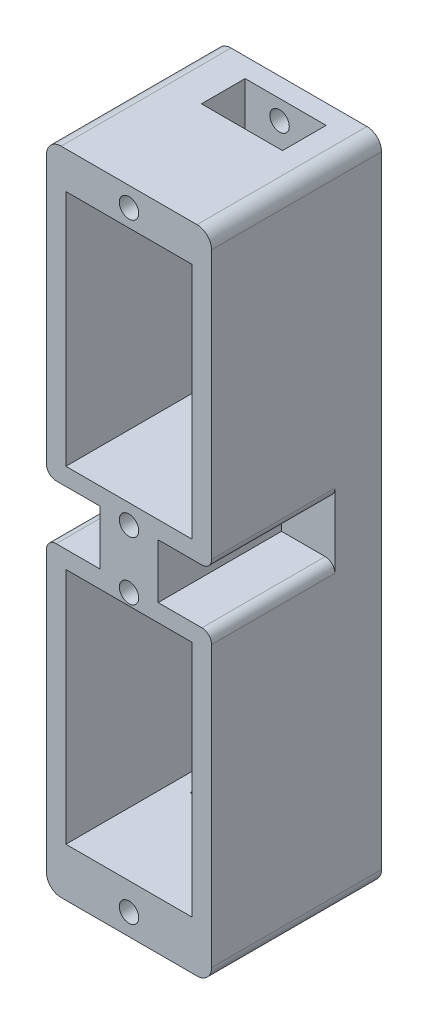
from build123d import *

# Parameters (mm, degrees)
SKETCH4_W           = 17
SKETCH4_H           = 67
BOSS_EXTRUDE1_DEPTH = 17.5
FILLET1_R           = 1.5
SKETCH5_W           = 13
SKETCH5_H           = 24.5
CUT_EXTRUDE1_DEPTH  = 14.5
SKETCH6_W           = 5.5
SKETCH6_H           = 5.6
CUT_EXTRUDE2_DEPTH  = 12.7
FILLET2_R           = 1
SKETCH7_R           = 1
CUT_EXTRUDE3_DEPTH  = 337.719561019
SKETCH8_W           = 9.5
SKETCH8_H           = 4.5
CUT_EXTRUDE4_DEPTH  = 5
SKETCH9_W           = 8.343526146
SKETCH9_H           = 4.5
CUT_EXTRUDE5_DEPTH  = 5


with BuildPart() as part:
    # Sketch4 → Boss-Extrude1 (new body)
    with BuildSketch(Plane.XY.offset(30)):
        with Locations((-184.236990356, 242.047210693)):
            Rectangle(SKETCH4_W, SKETCH4_H)
    extrude(amount=BOSS_EXTRUDE1_DEPTH)

    # Fillet1
    fillet1_edges = [part.edges().sort_by_distance(p)[0] for p in [
        (-192.736990356, 275.547210693, 38.75),
        (-175.736990356, 275.547210693, 38.75),
        (-192.736990356, 208.547210693, 38.75),
        (-175.736990356, 208.547210693, 38.75),
    ]]
    fillet(fillet1_edges, radius=FILLET1_R)

    # Sketch5 → Cut-Extrude1 (cut)
    with BuildSketch(Plane.XY.offset(47.5)):
        with Locations((-184.236990356, 259.497210693)):
            Rectangle(SKETCH5_W, SKETCH5_H)
        with Locations((-184.236990356, 225.797210693)):
            Rectangle(SKETCH5_W, SKETCH5_H)
    extrude(amount=-CUT_EXTRUDE1_DEPTH, mode=Mode.SUBTRACT)

    # Sketch6 → Cut-Extrude2 (cut)
    with BuildSketch(Plane.XY.offset(47.5)):
        with Locations((-189.986990356, 242.647210693)):
            Rectangle(SKETCH6_W, SKETCH6_H)
        with Locations((-178.486990356, 242.647210693)):
            Rectangle(SKETCH6_W, SKETCH6_H)
    extrude(amount=-CUT_EXTRUDE2_DEPTH, mode=Mode.SUBTRACT)

    # Fillet2
    fillet2_edges = [part.edges().sort_by_distance(p)[0] for p in [
        (-175.736990356, 239.847210693, 41.15),
        (-175.736990356, 245.447210693, 41.15),
        (-192.736990356, 239.847210693, 41.15),
        (-192.736990356, 245.447210693, 41.15),
    ]]
    fillet(fillet2_edges, radius=FILLET2_R)

    # Sketch7 → Cut-Extrude3 (cut, through all)
    with BuildSketch(Plane.XY.offset(47.5)):
        with Locations((-184.236990356, 273.547210693)):
            Circle(SKETCH7_R)
        with Locations((-184.236990356, 210.747210693)):
            Circle(SKETCH7_R)
        with Locations((-184.236990356, 245.247210693)):
            Circle(SKETCH7_R)
        with Locations((-184.236990356, 239.247210693)):
            Circle(SKETCH7_R)
    extrude(amount=-CUT_EXTRUDE3_DEPTH, mode=Mode.SUBTRACT)

    # Sketch8 → Cut-Extrude4 (cut)
    with BuildSketch(Plane(origin=(0, 208.547210693, 0), x_dir=(-1, 0, 0), z_dir=(0, -1, 0))):
        with Locations((184.186990356, -34.25)):
            Rectangle(SKETCH8_W, SKETCH8_H)
    extrude(amount=-CUT_EXTRUDE4_DEPTH, mode=Mode.SUBTRACT)

    # Sketch9 → Cut-Extrude5 (cut)
    with BuildSketch(Plane(origin=(0, 275.547210693, 0), x_dir=(1, 0, 0), z_dir=(0, 1, 0))):
        with Locations((-183.608753429, -34.25)):
            Rectangle(SKETCH9_W, SKETCH9_H)
    extrude(amount=-CUT_EXTRUDE5_DEPTH, mode=Mode.SUBTRACT)


solid = part.part
